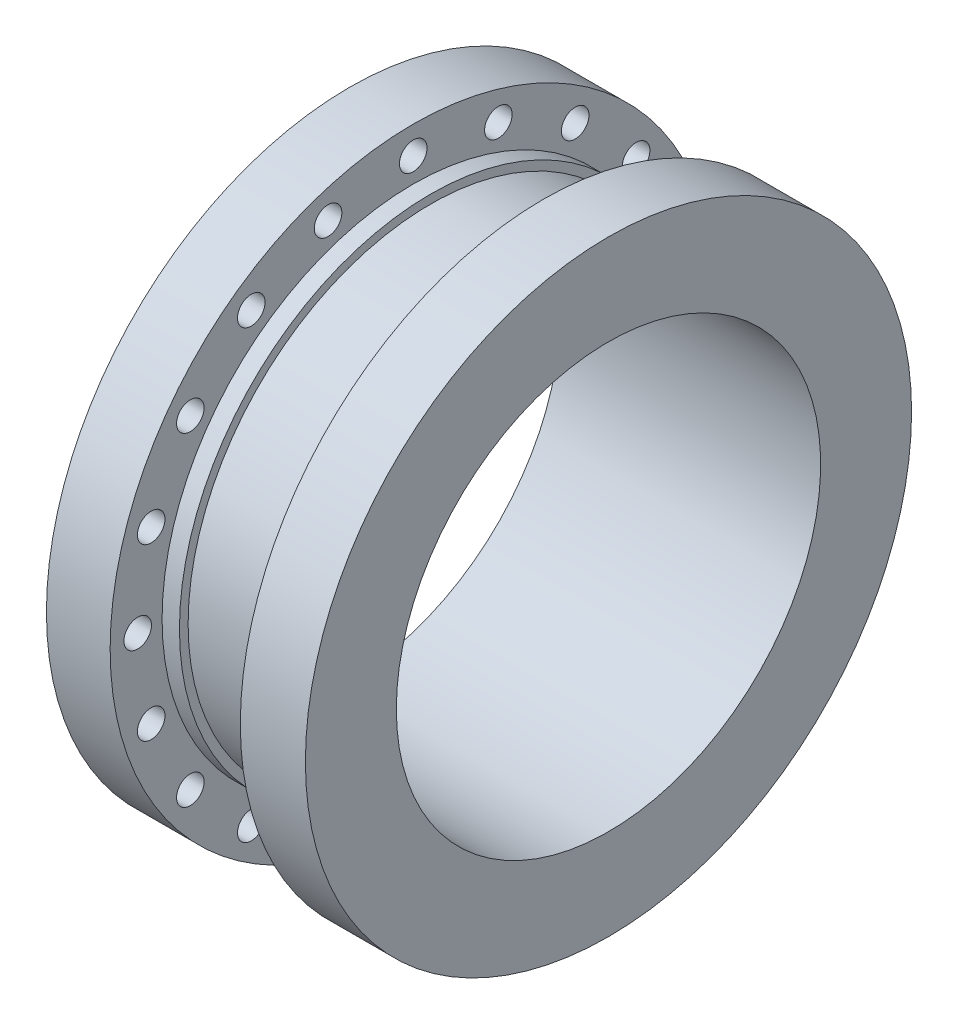
from build123d import *

# Parameters (mm, degrees)
F_25_0MM_DOWEL_HOLE1_D     = 31.75
F_25_0MM_DOWEL_HOLE1_DEPTH = 78.17
F_25_0MM_DOWEL_HOLE1_TIP   = 9.538662327
CUT_EXTRUDE1_START         = -1.5875
SKETCH5_R                  = 349.25
SKETCH5_R_2                = 292.1
CUT_EXTRUDE1_DEPTH         = 1.5875


with BuildPart() as part:
    # Sketch2 → Revolve1 (revolve)
    with BuildSketch(Plane.XY):
        Polygon((1800.036517194, -349.25), (1800.036517194, -289.4), (1820.036517194, -289.4), (1820.036517194, -279.4), (1930.036517194, -279.4), (1950.036517194, -299.4), (1950.036517194, -349.25), (2025.036517194, -349.25), (2025.036517194, -244.475), (1740.036517194, -244.475), (1725.036517194, -244.475), (1725.036517194, -349.25), align=None)
    revolve(axis=Axis((0, 0, 0), (1, 0, 0)))

    # Ø25.0mm Dowel Hole1
    with Locations(Plane(origin=(1725.036517194, 317.5, 0), x_dir=(0, 0, -1), z_dir=(-1, 0, 0))):
        with Locations((0, 0), (98.112895714, 15.539556076), (186.621817603, 60.637104286), (256.862895714, 130.878182397), (301.960443924, 219.387104286), (317.5, 317.5), (301.960443924, 415.612895714), (256.862895714, 504.121817603), (186.621817603, 574.362895714), (98.112895714, 619.460443924), (0, 635), (-98.112895714, 619.460443924), (-98.112895714, 15.539556076), (-186.621817603, 60.637104286), (-256.862895714, 130.878182397), (-301.960443924, 219.387104286), (-317.5, 317.5), (-301.960443924, 415.612895714), (-256.862895714, 504.121817603), (-186.621817603, 574.362895714)):
            Hole(F_25_0MM_DOWEL_HOLE1_D / 2, depth=F_25_0MM_DOWEL_HOLE1_DEPTH)
            with Locations((0, 0, -(F_25_0MM_DOWEL_HOLE1_DEPTH + F_25_0MM_DOWEL_HOLE1_TIP / 2))):  # 118° drill point
                Cone(0, F_25_0MM_DOWEL_HOLE1_D / 2, F_25_0MM_DOWEL_HOLE1_TIP, mode=Mode.SUBTRACT)

    # Sketch5 → Cut-Extrude1 (cut)
    with BuildSketch(Plane.ZY.offset(-1725.036517194).offset(CUT_EXTRUDE1_START)):
        Circle(SKETCH5_R)
        Circle(SKETCH5_R_2, mode=Mode.SUBTRACT)
    extrude(amount=CUT_EXTRUDE1_DEPTH, mode=Mode.SUBTRACT)


solid = part.part
